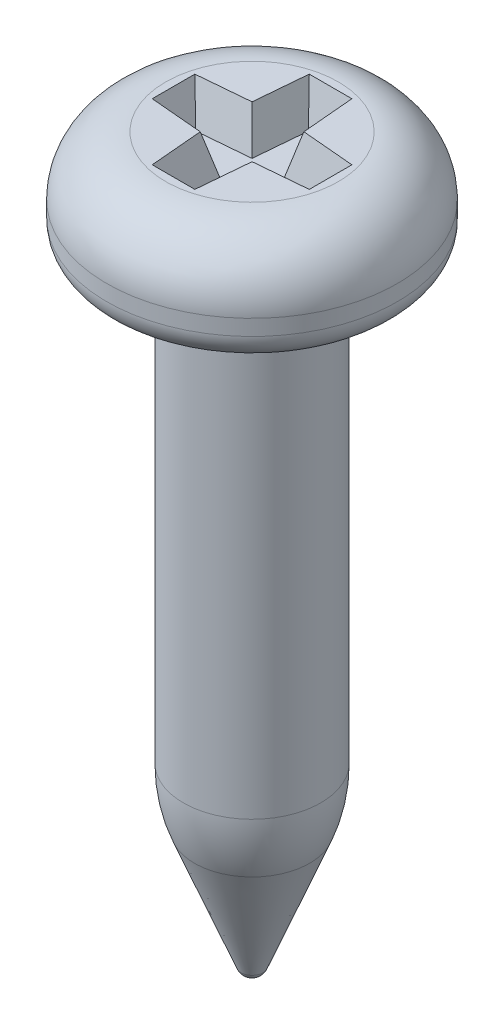
from build123d import *

# Parameters (mm, degrees)
CUT_EXTRUDE1_DEPTH = 0.5
CUT_EXTRUDE1_DRAFT = -15


with BuildPart() as part:
    # Sketch1 → Revolve1 (revolve)
    with BuildSketch(Plane.XY):
        with BuildLine():
            Line((0.875, -6.964405423), (0.875, -1.45))
            ThreePointArc((0.875, -1.45), (0.918933983, -1.343933983), (1.025, -1.3))
            Line((1.025, -1.3), (1.5, -1.3))
            ThreePointArc((1.5, -1.3), (1.747487373, -1.197487373), (1.85, -0.95))
            Line((1.85, -0.95), (1.85, -0.75))
            ThreePointArc((1.85, -0.75), (1.630330086, -0.219669914), (1.1, 0))
            Line((1.1, 0), (0, 0))
            Line((0, 0), (0, -9.3))
            ThreePointArc((0, -9.3), (0.084334338, -9.274047247), (0.139485899, -9.205169593))
            Line((0.139485899, -9.205169593), (0.734811985, -7.7))
            ThreePointArc((0.734811985, -7.7), (0.839640421, -7.338822324), (0.875, -6.964405423))
        make_face()
    revolve(axis=Axis((0, 0, 0), (0, -1, 0)))


with BuildPart() as cut_extrude1_tool:
    # Sketch2 → Cut-Extrude1 (with draft: the straight prism first)
    with BuildSketch(Plane(origin=(0, 0, 0), x_dir=(1, 0, 0), z_dir=(0, 1, 0))):
        Polygon((-0.271382595, 1), (-0.33, 0.33), (-1, 0.271382595), (-1, -0.271382595), (-0.33, -0.33), (-0.271382595, -1), (0.271382595, -1), (0.33, -0.33), (1, -0.271382595), (1, 0.271382595), (0.33, 0.33), (0.271382595, 1), align=None)
    extrude(amount=-CUT_EXTRUDE1_DEPTH)
    # Cut-Extrude1: the draft: its side faces are tilted about the plane it starts from
    cut_extrude1_sides = [cut_extrude1_tool.faces().sort_by_distance(p)[0] for p in [
        (-0.300691298, -0.25, -0.665),
        (-0.665, -0.25, -0.300691298),
        (-1, -0.25, 0),
        (-0.665, -0.25, 0.300691298),
        (-0.300691298, -0.25, 0.665),
        (0, -0.25, 1),
        (0.300691298, -0.25, 0.665),
        (0.665, -0.25, 0.300691298),
        (1, -0.25, 0),
        (0.665, -0.25, -0.300691298),
        (0.300691298, -0.25, -0.665),
        (0, -0.25, -1),
    ]]
    draft(cut_extrude1_sides, Plane(origin=(0, 0, 0), x_dir=(1, 0, 0), z_dir=(0, 1, 0)), CUT_EXTRUDE1_DRAFT)


with BuildPart() as part_1:
    add(part.part)

    # Cut-Extrude1: cut by cut_extrude1_tool
    add(cut_extrude1_tool.part, mode=Mode.SUBTRACT)


solid = part_1.part
